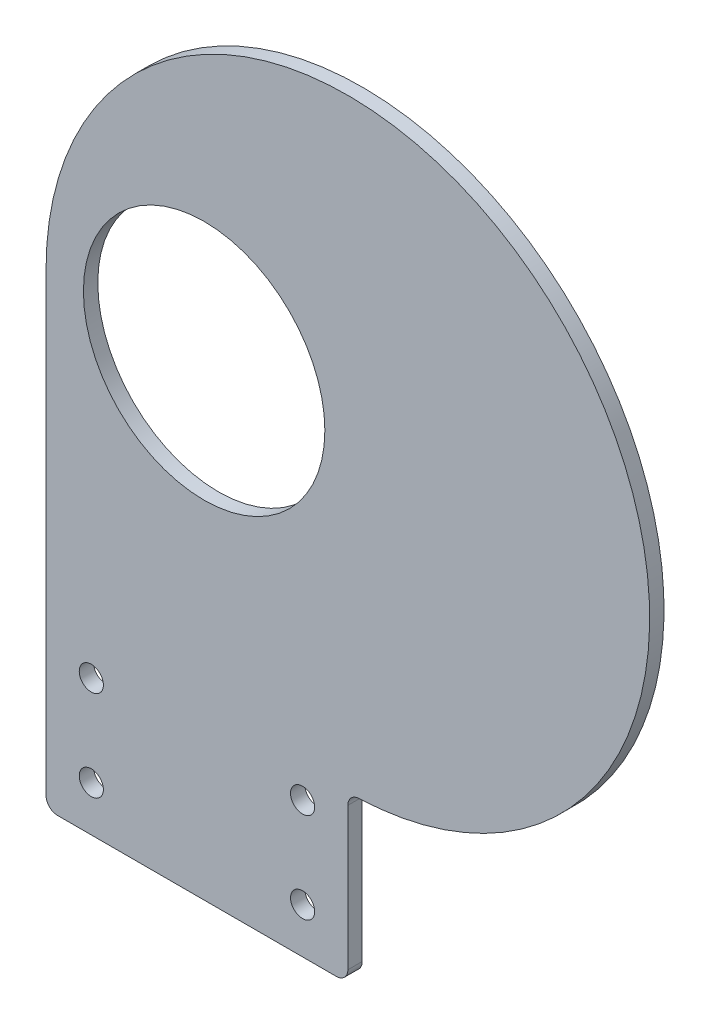
from build123d import *

# Parameters (mm, degrees)
SKETCH1_R           = 26.67
BOSS_EXTRUDE1_DEPTH = 3.175
CUT_EXTRUDE1_REACH  = 144.628
CUT_EXTRUDE2_REACH  = 144.628
SKETCH3_R           = 2.665
FILLET1_R           = 2.54


with BuildPart() as part:
    # Sketch1 → Boss-Extrude1 (new body)
    with BuildSketch(Plane.XY):
        with BuildLine():
            Line((-34.925, 0), (-34.925, -63.5))
            Line((-34.925, -63.5), (-34.925, -103.175))
            Line((-34.925, -103.175), (98.425, -103.175))
            Line((98.425, -103.175), (98.425, -64.833888838))
            Line((98.425, -64.833888838), (98.425, 0))
            ThreePointArc((98.425, 0), (31.75, 66.675), (-34.925, 0))
        make_face()
        Circle(SKETCH1_R, mode=Mode.SUBTRACT)
    extrude(amount=BOSS_EXTRUDE1_DEPTH)

    # Sketch2 → Cut-Extrude1 (cut, up to next)
    with BuildSketch(Plane.XY.offset(3.175), mode=Mode.PRIVATE) as cut_extrude1_sk1:
        with BuildLine():
            Line((31.75, -66.675), (31.75, -103.175))
            Line((31.75, -103.175), (98.425, -103.175))
            Line((98.425, -103.175), (98.425, 0))
            ThreePointArc((98.425, 0), (78.896344636, -47.146344636), (31.75, -66.675))
        make_face()
    cut_extrude1_tool1 = extrude(cut_extrude1_sk1.sketch, amount=-CUT_EXTRUDE1_REACH, mode=Mode.PRIVATE) & part.part
    add(cut_extrude1_tool1.solids().sort_by_distance((70.281775, -75.59134, 3.175))[0], mode=Mode.SUBTRACT)

    # Sketch3 → Cut-Extrude2 (cut, up to next)
    with BuildSketch(Plane(origin=(0, 0, 0), x_dir=(-1, 0, 0), z_dir=(0, 0, -1)), mode=Mode.PRIVATE) as cut_extrude2_sk1:
        with Locations((-21.75, -93.175)):
            Circle(SKETCH3_R)
    cut_extrude2_tool1 = extrude(cut_extrude2_sk1.sketch, amount=-CUT_EXTRUDE2_REACH, mode=Mode.PRIVATE) & part.part
    # Sketch3 → Cut-Extrude2 (cut, up to next)
    with BuildSketch(Plane(origin=(0, 0, 0), x_dir=(-1, 0, 0), z_dir=(0, 0, -1)), mode=Mode.PRIVATE) as cut_extrude2_sk2:
        with Locations((-21.75, -73.175)):
            Circle(SKETCH3_R)
    cut_extrude2_tool2 = extrude(cut_extrude2_sk2.sketch, amount=-CUT_EXTRUDE2_REACH, mode=Mode.PRIVATE) & part.part
    # Sketch3 → Cut-Extrude2 (cut, up to next)
    with BuildSketch(Plane(origin=(0, 0, 0), x_dir=(-1, 0, 0), z_dir=(0, 0, -1)), mode=Mode.PRIVATE) as cut_extrude2_sk3:
        with Locations((24.925, -93.175)):
            Circle(SKETCH3_R)
    cut_extrude2_tool3 = extrude(cut_extrude2_sk3.sketch, amount=-CUT_EXTRUDE2_REACH, mode=Mode.PRIVATE) & part.part
    # Sketch3 → Cut-Extrude2 (cut, up to next)
    with BuildSketch(Plane(origin=(0, 0, 0), x_dir=(-1, 0, 0), z_dir=(0, 0, -1)), mode=Mode.PRIVATE) as cut_extrude2_sk4:
        with Locations((24.925, -73.175)):
            Circle(SKETCH3_R)
    cut_extrude2_tool4 = extrude(cut_extrude2_sk4.sketch, amount=-CUT_EXTRUDE2_REACH, mode=Mode.PRIVATE) & part.part
    add(cut_extrude2_tool1.solids().sort_by_distance((21.75, -93.175, 0))[0], mode=Mode.SUBTRACT)
    add(cut_extrude2_tool2.solids().sort_by_distance((21.75, -73.175, 0))[0], mode=Mode.SUBTRACT)
    add(cut_extrude2_tool3.solids().sort_by_distance((-24.925, -93.175, 0))[0], mode=Mode.SUBTRACT)
    add(cut_extrude2_tool4.solids().sort_by_distance((-24.925, -73.175, 0))[0], mode=Mode.SUBTRACT)

    # Fillet1
    fillet1_edges = [part.edges().sort_by_distance(p)[0] for p in [
        (-34.925, -103.175, 1.5875),
        (31.75, -103.175, 1.5875),
        (31.75, -66.675, 1.5875),
    ]]
    fillet(fillet1_edges, radius=FILLET1_R)


solid = part.part
